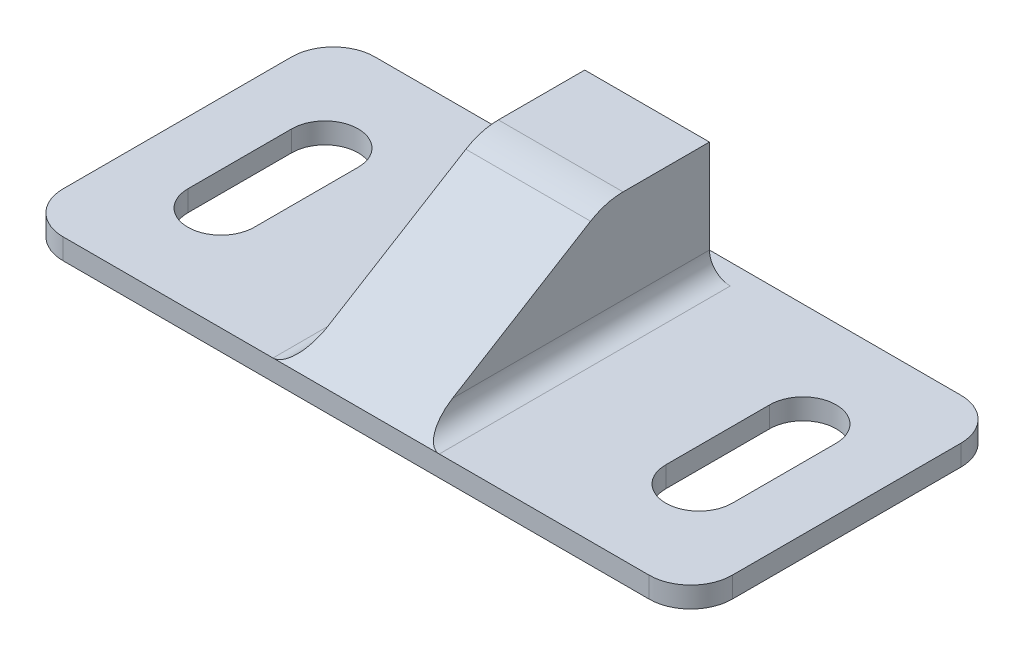
from build123d import *

# Parameters (mm, degrees)
BOSS_EXTRUDE1_DEPTH      = 1
BOSS_EXTRUDE2_DEPTH      = 3
BOSS_EXTRUDE2_DEPTH_BACK = 3
FILLET1_R                = 1


with BuildPart() as part:
    # Sketch1 → Boss-Extrude1 (new body)
    with BuildSketch(Plane(origin=(0, 0, 0), x_dir=(1, 0, 0), z_dir=(0, 1, 0))):
        with BuildLine():
            Line((-14.1, -7.5), (14.1, -7.5))
            ThreePointArc((14.1, -7.5), (15.514213562, -6.914213562), (16.1, -5.5))
            Line((16.1, -5.5), (16.1, 5.5))
            ThreePointArc((16.1, 5.5), (15.514213562, 6.914213562), (14.1, 7.5))
            Line((14.1, 7.5), (-14.1, 7.5))
            ThreePointArc((-14.1, 7.5), (-15.514213562, 6.914213562), (-16.1, 5.5))
            Line((-16.1, 5.5), (-16.1, -5.5))
            ThreePointArc((-16.1, -5.5), (-15.514213562, -6.914213562), (-14.1, -7.5))
        make_face()
        with BuildLine():
            Line((9.9, -2.5), (9.9, 2.5))
            ThreePointArc((9.9, 2.5), (11.5, 4.1), (13.1, 2.5))
            Line((13.1, 2.5), (13.1, -2.5))
            ThreePointArc((13.1, -2.5), (11.5, -4.1), (9.9, -2.5))
        make_face(mode=Mode.SUBTRACT)
        with BuildLine():
            Line((-9.9, -2.5), (-9.9, 2.5))
            ThreePointArc((-9.9, 2.5), (-11.5, 4.1), (-13.1, 2.5))
            Line((-13.1, 2.5), (-13.1, -2.5))
            ThreePointArc((-13.1, -2.5), (-11.5, -4.1), (-9.9, -2.5))
        make_face(mode=Mode.SUBTRACT)
    extrude(amount=BOSS_EXTRUDE1_DEPTH)

    # Sketch2 → Boss-Extrude2 (add, two sides: drawn at the far end of the back side and taken through both)
    with BuildSketch(Plane(origin=(0, 0, 0), x_dir=(0, 0, -1), z_dir=(1, 0, 0)).offset(-BOSS_EXTRUDE2_DEPTH_BACK)):
        with BuildLine():
            Line((6.5, 6.5), (6.5, 1))
            Line((6.5, 1), (-7.5, 1))
            Line((-7.5, 1), (0.779747183, 6.059845501))
            ThreePointArc((0.779747183, 6.059845501), (1.531550752, 6.387865691), (2.344097212, 6.5))
            Line((2.344097212, 6.5), (6.5, 6.5))
        make_face()
    extrude(amount=BOSS_EXTRUDE2_DEPTH + BOSS_EXTRUDE2_DEPTH_BACK)

    # Fillet1
    # the kernel refuses this fillet: 1 mm, written as the material it adds along each edge
    with BuildSketch(Plane(origin=(-3, 1, -6.5), x_dir=(-1, 0, 0), z_dir=(0, 0, 1))) as fillet1_piece_1_section:
        with BuildLine():
            CenterArc((FILLET1_R, -FILLET1_R), FILLET1_R, 90, 90)
            Line((0, -FILLET1_R), (0, 0))
            Line((0, 0), (FILLET1_R, 0))
        make_face()
    fillet1_piece_1 = extrude(amount=14, mode=Mode.PRIVATE)
    fillet1_piece_1 = split(fillet1_piece_1, bisect_by=Plane(origin=(-3.229666566, 4.255348718, 2.173065734), z_dir=(0, -0.8532818336519591, -0.5214500094539749)), keep=Keep.TOP, mode=Mode.PRIVATE)
    add(fillet1_piece_1)
    with BuildSketch(Plane(origin=(3, 1, -6.5), x_dir=(1, 0, 0), z_dir=(0, 0, 1))) as fillet1_piece_2_section:
        with BuildLine():
            CenterArc((FILLET1_R, FILLET1_R), FILLET1_R, 180, 90)
            Line((0, FILLET1_R), (0, 0))
            Line((0, 0), (FILLET1_R, 0))
        make_face()
    fillet1_piece_2 = extrude(amount=14, mode=Mode.PRIVATE)
    fillet1_piece_2 = split(fillet1_piece_2, bisect_by=Plane(origin=(3.229666566, 4.255348718, 2.173065734), z_dir=(0, -0.8532818336519591, -0.5214500094539749)), keep=Keep.TOP, mode=Mode.PRIVATE)
    add(fillet1_piece_2)


solid = part.part
